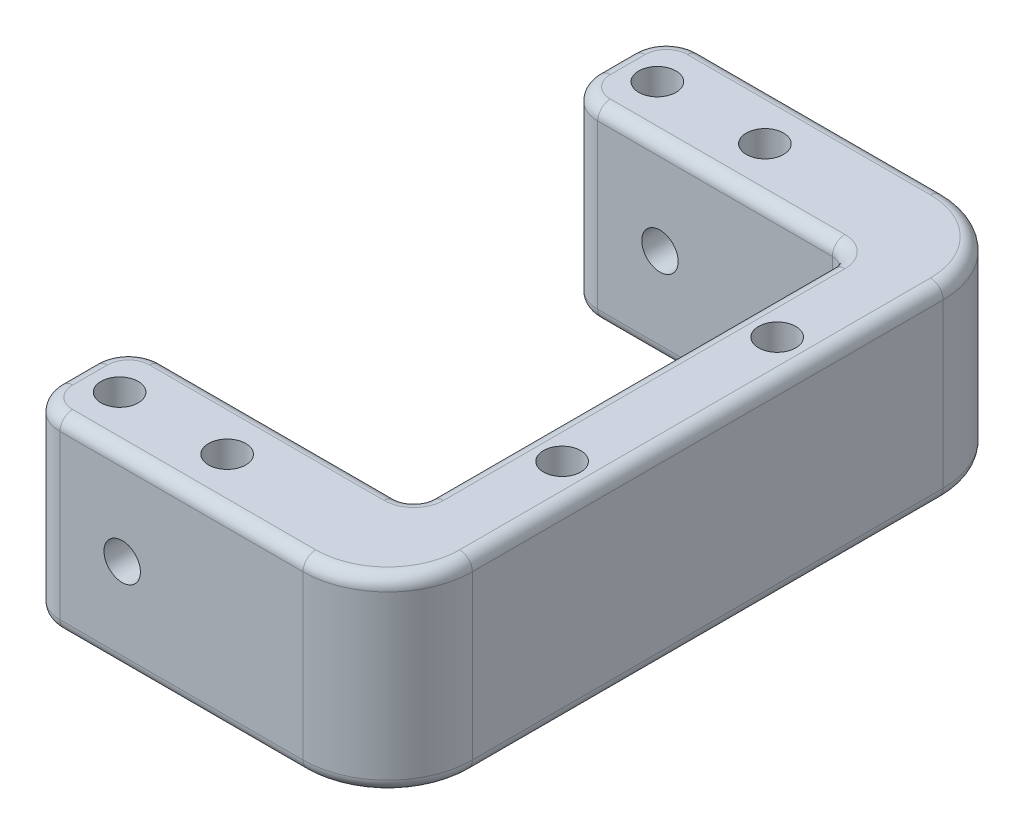
from build123d import *

# Parameters (mm, degrees)
SKETCH1_R           = 2.2
BOSS_EXTRUDE1_DEPTH = 22.2504
FILLET1_R           = 10
FILLET2_R           = 2
FILLET3_R           = 4
FILLET4_R           = 1.5
SKETCH2_R           = 2.15
CUT_EXTRUDE1_DEPTH  = 88.351467488


with BuildPart() as part:
    # Sketch1 → Boss-Extrude1 (new body)
    with BuildSketch(Plane(origin=(0, 0, 0), x_dir=(1, 0, 0), z_dir=(0, 1, 0))):
        Polygon((28.7, 6.0452), (-5, 6.0452), (-5, -6.0452), (37.7, -6.0452), (37.7, 69.5452), (-5, 69.5452), (-5, 57.4548), (28.7, 57.4548), align=None)
        Circle(SKETCH1_R, mode=Mode.SUBTRACT)
        with Locations((12.7, 0)):
            Circle(SKETCH1_R, mode=Mode.SUBTRACT)
        with Locations((33.2, 19.05)):
            Circle(SKETCH1_R, mode=Mode.SUBTRACT)
        with Locations((0, 63.5)):
            Circle(SKETCH1_R, mode=Mode.SUBTRACT)
        with Locations((12.7, 63.5)):
            Circle(SKETCH1_R, mode=Mode.SUBTRACT)
        with Locations((33.2, 44.45)):
            Circle(SKETCH1_R, mode=Mode.SUBTRACT)
    extrude(amount=BOSS_EXTRUDE1_DEPTH)

    # Fillet1
    fillet1_edges = [part.edges().sort_by_distance(p)[0] for p in [
        (37.7, 11.1252, -69.5452),
        (37.7, 11.1252, 6.0452),
    ]]
    fillet(fillet1_edges, radius=FILLET1_R)

    # Fillet2
    fillet2_edges = [part.edges().sort_by_distance(p)[0] for p in [
        (28.7, 11.1252, -57.4548),
        (28.7, 11.1252, -6.0452),
    ]]
    fillet(fillet2_edges, radius=FILLET2_R)

    # Fillet3
    fillet3_edges = [part.edges().sort_by_distance(p)[0] for p in [
        (-5, 11.1252, -69.5452),
        (-5, 11.1252, -57.4548),
        (-5, 11.1252, -6.0452),
        (-5, 11.1252, 6.0452),
    ]]
    fillet(fillet3_edges, radius=FILLET3_R)

    # Fillet4
    fillet4_edges = [part.edges().sort_by_distance(p)[0] for p in [
        (-3.828427125, 0, -4.873627125),
        (12.85, 0, -6.0452),
        (28.114213562, 0, -6.630986438),
        (28.7, 0, -31.75),
        (28.114213562, 0, -56.869013562),
        (12.85, 0, -57.4548),
        (-3.828427125, 0, -58.626372875),
        (-3.828427125, 0, -68.373627125),
        (13.35, 0, -69.5452),
        (34.771067812, 0, -66.616267812),
        (37.7, 0, -31.75),
        (-3.828427125, 22.2504, -4.873627125),
        (12.85, 22.2504, -6.0452),
        (28.114213562, 22.2504, -6.630986438),
        (28.7, 22.2504, -31.75),
        (28.114213562, 22.2504, -56.869013562),
        (12.85, 22.2504, -57.4548),
        (-3.828427125, 22.2504, -58.626372875),
        (-3.828427125, 22.2504, -68.373627125),
        (13.35, 22.2504, -69.5452),
        (34.771067812, 22.2504, -66.616267812),
        (37.7, 22.2504, -31.75),
        (-3.828427125, 0, 4.873627125),
        (34.771067812, 0, 3.116267812),
        (-3.828427125, 22.2504, 4.873627125),
        (34.771067812, 22.2504, 3.116267812),
        (13.35, 0, 6.0452),
        (13.35, 22.2504, 6.0452),
        (-5, 0, 0),
        (-5, 0, -63.5),
        (-5, 22.2504, 0),
        (-5, 22.2504, -63.5),
    ]]
    fillet(fillet4_edges, radius=FILLET4_R)

    # Sketch2 → Cut-Extrude1 (cut, through all)
    with BuildSketch(Plane.XY.offset(6.0452)):
        with Locations((6.35, 11.1252)):
            Circle(SKETCH2_R)
    extrude(amount=-CUT_EXTRUDE1_DEPTH, mode=Mode.SUBTRACT)


solid = part.part
